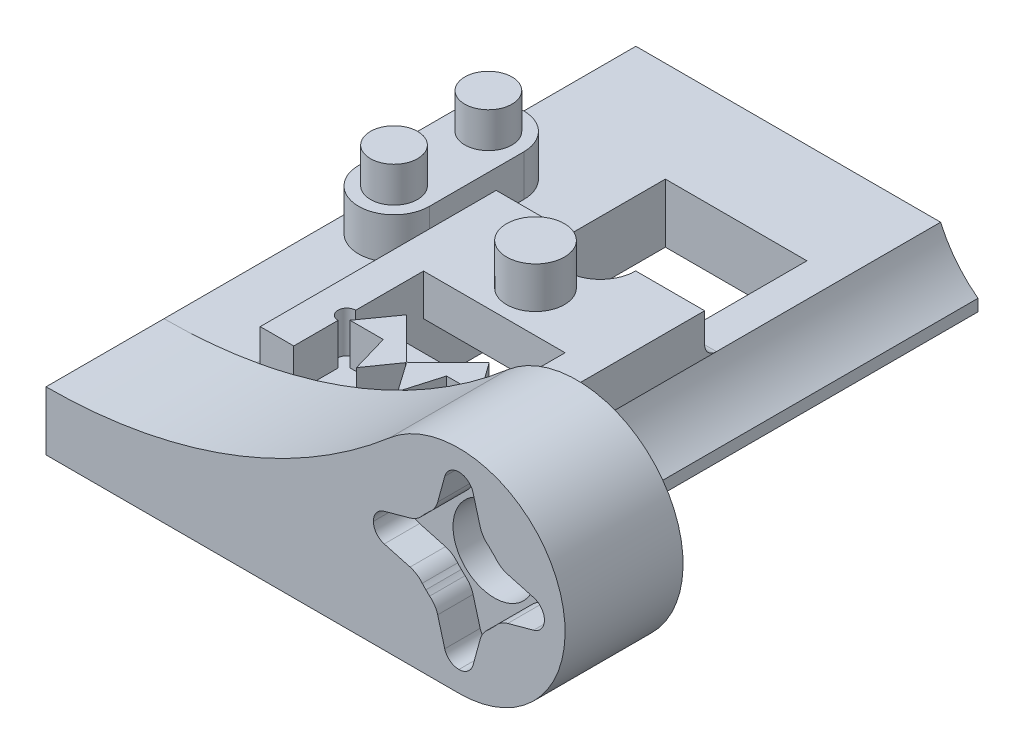
from build123d import *

# Parameters (mm, degrees)
SKETCH1_R                     = 9
BOSS_EXTRUDE1_DEPTH           = 5
SKETCH2_R                     = 7
BOSS_EXTRUDE2_DEPTH           = 1.5
BOSS_EXTRUDE2_TAPER           = 30
BOSS_EXTRUDE2_OTHER_WAY_DEPTH = 1.5
BOSS_EXTRUDE2_OTHER_WAY_TAPER = 30
CUT_EXTRUDE1_DEPTH            = 3
BOSS_EXTRUDE3_DEPTH           = 40
SKETCH5_W                     = 12
SKETCH5_H                     = 23
CUT_EXTRUDE2_DEPTH            = 40
BOSS_EXTRUDE4_DEPTH           = 3.5
SKETCH7_R                     = 2
BOSS_EXTRUDE5_DEPTH           = 3
SKETCH8_R                     = 3.5
CUT_EXTRUDE3_DEPTH            = 53.803882433
BOSS_EXTRUDE6_DEPTH           = 3.5
SKETCH10_R                    = 2.45
BOSS_EXTRUDE7_DEPTH           = 3.5
BOSS_EXTRUDE8_DEPTH           = 3.5
FILLET1_START                 = -26.84
FILLET1_DEPTH                 = 2.84
FILLET1_START_2               = -12
FILLET1_2_DEPTH               = 2.83
FILLET1_START_3               = -26
FILLET1_3_DEPTH               = 21
FILLET1_START_4               = -27.84
FILLET1_4_DEPTH               = 1


with BuildPart() as part:
    # Sketch1 → Boss-Extrude1 (new, symmetric)
    with BuildSketch(Plane.XY):
        Circle(SKETCH1_R)
        with BuildLine():
            Line((-35, -9), (0, -9))
            ThreePointArc((0, -9), (-8.437416666, -3.132091953), (-5.872614409, 6.82))
            ThreePointArc((-5.872614409, 6.82), (-19.465199243, -1.204217751), (-35, -4))
            Line((-35, -4), (-35, -9))
        make_face()
    extrude(amount=BOSS_EXTRUDE1_DEPTH, both=True)

    # Sketch2 → Boss-Extrude2 (add)
    with BuildSketch(Plane(origin=(0, 0, -5), x_dir=(-1, 0, 0), z_dir=(0, 0, -1))):
        Circle(SKETCH2_R)
    extrude(amount=BOSS_EXTRUDE2_DEPTH, taper=BOSS_EXTRUDE2_TAPER)

    # Sketch2 → Boss-Extrude2 other way (add)
    with BuildSketch(Plane(origin=(0, 0, -5), x_dir=(-1, 0, 0), z_dir=(0, 0, -1))):
        Circle(SKETCH2_R)
    extrude(amount=-BOSS_EXTRUDE2_OTHER_WAY_DEPTH, taper=BOSS_EXTRUDE2_OTHER_WAY_TAPER)

    # Sketch3 → Cut-Extrude1 (cut)
    with BuildSketch(Plane.XY.offset(5)):
        with BuildLine():
            Line((1.2, -6.33), (1.8, -4.1378116))
            ThreePointArc((1.8, -4.1378116), (2.058560194, -3.569045514), (2.48, -3.1078116))
            ThreePointArc((2.48, -3.1078116), (2.641475661, -2.955390865), (2.794244497, -2.794244497))
            ThreePointArc((2.794244497, -2.794244497), (2.955390865, -2.641475661), (3.1078116, -2.48))
            ThreePointArc((3.1078116, -2.48), (3.569045514, -2.058560194), (4.1378116, -1.8))
            Line((4.1378116, -1.8), (6.33, -1.2))
            ThreePointArc((6.33, -1.2), (6.992020752, -0.754882576), (7.25, 0))
            ThreePointArc((7.25, 0), (6.992020752, 0.754882576), (6.33, 1.2))
            Line((6.33, 1.2), (4.1378116, 1.8))
            ThreePointArc((4.1378116, 1.8), (3.569045514, 2.058560194), (3.1078116, 2.48))
            ThreePointArc((3.1078116, 2.48), (2.955390865, 2.641475661), (2.794244497, 2.794244497))
            ThreePointArc((2.794244497, 2.794244497), (2.641475661, 2.955390865), (2.48, 3.1078116))
            ThreePointArc((2.48, 3.1078116), (2.058560194, 3.569045514), (1.8, 4.1378116))
            Line((1.8, 4.1378116), (1.2, 6.33))
            ThreePointArc((1.2, 6.33), (0.754882576, 6.992020752), (0, 7.25))
            ThreePointArc((0, 7.25), (-0.754882576, 6.992020752), (-1.2, 6.33))
            Line((-1.2, 6.33), (-1.8, 4.1378116))
            ThreePointArc((-1.8, 4.1378116), (-2.058560194, 3.569045514), (-2.48, 3.1078116))
            ThreePointArc((-2.48, 3.1078116), (-2.641475661, 2.955390865), (-2.794244497, 2.794244497))
            ThreePointArc((-2.794244497, 2.794244497), (-2.955390865, 2.641475661), (-3.1078116, 2.48))
            ThreePointArc((-3.1078116, 2.48), (-3.569045514, 2.058560194), (-4.1378116, 1.8))
            Line((-4.1378116, 1.8), (-6.33, 1.2))
            ThreePointArc((-6.33, 1.2), (-6.992020752, 0.754882576), (-7.25, 0))
            ThreePointArc((-7.25, 0), (-6.992020752, -0.754882576), (-6.33, -1.2))
            Line((-6.33, -1.2), (-4.1378116, -1.8))
            ThreePointArc((-4.1378116, -1.8), (-3.569045514, -2.058560194), (-3.1078116, -2.48))
            ThreePointArc((-3.1078116, -2.48), (-2.955390865, -2.641475661), (-2.794244497, -2.794244497))
            ThreePointArc((-2.794244497, -2.794244497), (-2.641475661, -2.955390865), (-2.48, -3.1078116))
            ThreePointArc((-2.48, -3.1078116), (-2.058560194, -3.569045514), (-1.8, -4.1378116))
            Line((-1.8, -4.1378116), (-1.2, -6.33))
            ThreePointArc((-1.2, -6.33), (-0.754882576, -6.992020752), (0, -7.25))
            ThreePointArc((0, -7.25), (0.754882576, -6.992020752), (1.2, -6.33))
        make_face()
    extrude(amount=-CUT_EXTRUDE1_DEPTH, mode=Mode.SUBTRACT)

    # Sketch4 → Boss-Extrude3 (add)
    with BuildSketch(Plane(origin=(0, 0, -5), x_dir=(-1, 0, 0), z_dir=(0, 0, -1))):
        with BuildLine():
            Line((35, -9), (35, -4))
            Line((35, -4), (9.17, -4))
            ThreePointArc((9.17, -4), (7.844486312, -6.205642902), (6, -8))
            Line((6, -8), (6, -9))
            Line((6, -9), (35, -9))
        make_face()
    extrude(amount=BOSS_EXTRUDE3_DEPTH)

    # Sketch5 → Cut-Extrude2 (cut)
    with BuildSketch(Plane(origin=(0, -4, 0), x_dir=(1, 0, 0), z_dir=(0, 1, 0))):
        with Locations((-18, 25)):
            Rectangle(SKETCH5_W, SKETCH5_H)
    extrude(amount=-CUT_EXTRUDE2_DEPTH, mode=Mode.SUBTRACT)

    # Sketch6 → Boss-Extrude4 (add)
    with BuildSketch(Plane(origin=(0, -4, 0), x_dir=(1, 0, 0), z_dir=(0, 1, 0))):
        with BuildLine():
            Line((-28.5, 29), (-28.5, 21))
            ThreePointArc((-28.5, 21), (-31.5, 18), (-34.5, 21))
            Line((-34.5, 21), (-34.5, 29))
            ThreePointArc((-34.5, 29), (-31.5, 32), (-28.5, 29))
        make_face()
    extrude(amount=BOSS_EXTRUDE4_DEPTH)

    # Sketch7 → Boss-Extrude5 (add)
    with BuildSketch(Plane(origin=(0, -0.5, 0), x_dir=(1, 0, 0), z_dir=(0, 1, 0))):
        with Locations(Location((-31.5, 29, 0), (0, 0, 180))):
            Circle(SKETCH7_R)
        with Locations(Location((-31.5, 21, 0), (0, 0, 180))):
            Circle(SKETCH7_R)
    extrude(amount=BOSS_EXTRUDE5_DEPTH)

    # Sketch8 → Cut-Extrude3 (cut, through all)
    with BuildSketch(Plane(origin=(0, 0, -6.5), x_dir=(-1, 0, 0), z_dir=(0, 0, -1))):
        Circle(SKETCH8_R)
    extrude(amount=-CUT_EXTRUDE3_DEPTH, mode=Mode.SUBTRACT)

    # Sketch9 → Boss-Extrude6 (add)
    with BuildSketch(Plane(origin=(0, -4, 0), x_dir=(1, 0, 0), z_dir=(0, 1, 0))):
        with BuildLine():
            Line((-26.84, 5), (-26.84, 25))
            Line((-26.84, 25), (-21.01, 25))
            ThreePointArc((-21.01, 25), (-18.01, 22), (-15.01, 25))
            Line((-15.01, 25), (-9.17, 25))
            Line((-9.17, 25), (-9.17, 5))
            Line((-9.17, 5), (-12, 5))
            Line((-12, 5), (-12, 8.75))
            ThreePointArc((-12, 8.75), (-11.25, 9.5), (-12, 10.25))
            Line((-12, 10.25), (-12, 16))
            Line((-12, 16), (-17.99, 16))
            Line((-17.99, 16), (-18.01, 16))
            Line((-18.01, 16), (-24, 16))
            Line((-24, 16), (-24, 10.25))
            ThreePointArc((-24, 10.25), (-24.75, 9.5), (-24, 8.75))
            Line((-24, 8.75), (-24, 5))
            Line((-24, 5), (-26.84, 5))
        make_face()
    extrude(amount=BOSS_EXTRUDE6_DEPTH)

    # Sketch10 → Boss-Extrude7 (add)
    with BuildSketch(Plane(origin=(0, -0.5, 0), x_dir=(1, 0, 0), z_dir=(0, 1, 0))):
        with Locations(Location((-18.005833333, 19.5, 0), (0, 0, 180))):
            Circle(SKETCH10_R)
    extrude(amount=BOSS_EXTRUDE7_DEPTH)

    # Sketch11 → Boss-Extrude8 (add)
    with BuildSketch(Plane(origin=(0, -4, 0), x_dir=(1, 0, 0), z_dir=(0, 1, 0))):
        Polygon((-20.68, 9.27091935), (-23.5, 9.27091935), (-21.5, 12.07091935), (-18.05, 8.62091935), (-18, 8.62091935), (-17.95, 8.62091935), (-14.5, 12.07091935), (-12.5, 9.27091935), (-15.32, 9.27091935), (-16.25, 6.07091935), (-17.97, 8.52091935), (-18.03, 8.52091935), (-19.75, 6.07091935), align=None)
    extrude(amount=BOSS_EXTRUDE8_DEPTH)

    # Fillet1: read off the stored shape, not the designer's step
    # Fillet1 outline → Fillet1 (add)
    with BuildSketch(Plane.YZ.offset(FILLET1_START)):
        with BuildLine():
            ThreePointArc((-4, -26), (-3.707106781, -25.292893219), (-3, -25))
            Line((-3, -25), (-4, -25))
            Line((-4, -25), (-4, -26))
        make_face()
    extrude(amount=FILLET1_DEPTH)

    # Fillet1 2 outline → Fillet1 2 (add)
    with BuildSketch(Plane.YZ.offset(FILLET1_START_2)):
        with BuildLine():
            ThreePointArc((-4, -26), (-3.707106781, -25.292893219), (-3, -25))
            Line((-3, -25), (-4, -25))
            Line((-4, -25), (-4, -26))
        make_face()
    extrude(amount=FILLET1_2_DEPTH)

    # Fillet1 3 outline → Fillet1 3 (add)
    with BuildSketch(Plane.XY.offset(FILLET1_START_3)):
        with BuildLine():
            Line((-26.84, -4), (-26.84, -3))
            ThreePointArc((-26.84, -3), (-27.132893219, -3.707106781), (-27.84, -4))
            Line((-27.84, -4), (-26.84, -4))
        make_face()
    extrude(amount=FILLET1_3_DEPTH)

    # Fillet1 4 outline → Fillet1 4 (cut)
    with BuildSketch(Plane.YZ.offset(FILLET1_START_4)):
        with BuildLine():
            Line((-2, -24.999999999), (-3, -25))
            ThreePointArc((-3, -25), (-3.707106781, -25.292893219), (-4, -26))
            Line((-4, -26), (-2, -26))
            Line((-2, -26), (-2, -24.999999999))
        make_face()
    extrude(amount=FILLET1_4_DEPTH, mode=Mode.SUBTRACT)


solid = part.part
